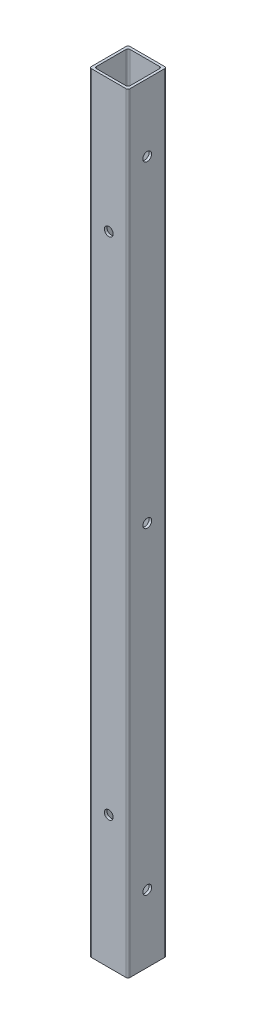
from build123d import *

# Parameters (mm, degrees)
SKETCH1_W                  = 25.4
SKETCH1_H                  = 25.4
SKETCH1_W_2                = 22.098
SKETCH1_H_2                = 22.098
BOSS_EXTRUDE1_DEPTH        = 508
FILLET1_R                  = 1.27
F_1_0_228_DIAMETER_HOLE2_D = 5.7912
F_1_0_228_DIAMETER_HOLE3_D = 5.7912


with BuildPart() as part:
    # Sketch1 → Boss-Extrude1 (new body)
    with BuildSketch(Plane(origin=(0, 0, 0), x_dir=(1, 0, 0), z_dir=(0, 1, 0))):
        Rectangle(SKETCH1_W, SKETCH1_H)
        Rectangle(SKETCH1_W_2, SKETCH1_H_2, mode=Mode.SUBTRACT)
    extrude(amount=BOSS_EXTRUDE1_DEPTH)

    # Fillet1
    fillet1_edges = [part.edges().sort_by_distance(p)[0] for p in [
        (-12.7, 254, 12.7),
        (-12.7, 254, -12.7),
        (12.7, 254, -12.7),
        (12.7, 254, 12.7),
        (-11.049, 254, -11.049),
        (11.049, 254, 11.049),
        (11.049, 254, -11.049),
        (-11.049, 254, 11.049),
    ]]
    fillet(fillet1_edges, radius=FILLET1_R)

    # #1 (0.228) Diameter Hole2 (through all)
    with Locations(Plane.ZY.offset(12.7)):
        with Locations((0, 463.55), (0, 44.45), (0, 254)):
            Hole(F_1_0_228_DIAMETER_HOLE2_D / 2)

    # #1 (0.228) Diameter Hole3 (through all)
    with Locations(Plane(origin=(0, 0, -12.7), x_dir=(-1, 0, 0), z_dir=(0, 0, -1))):
        with Locations((0, 420.6875), (0, 87.3125)):
            Hole(F_1_0_228_DIAMETER_HOLE3_D / 2)


solid = part.part
